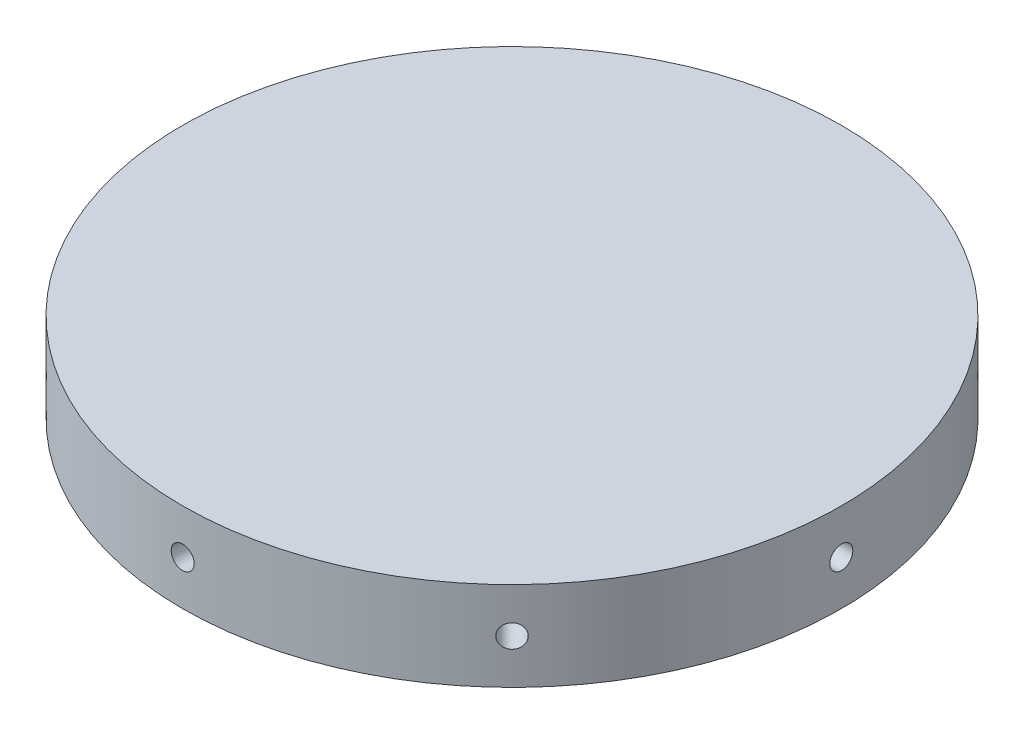
from build123d import *

# Parameters (mm, degrees)
SKETCH1_R                = 46.99
BULKHEAD_EXTRUSION_DEPTH = 12.7
SKETCH2_R                = 1.6383
SCREW_HOLE_DEPTH         = 12.7
CIRPATTERN1_COUNT        = 8


with BuildPart() as part:
    # Sketch1 → Bulkhead Extrusion (new body)
    with BuildSketch(Plane(origin=(0, 0, 0), x_dir=(1, 0, 0), z_dir=(0, 1, 0))):
        Circle(SKETCH1_R)
    extrude(amount=BULKHEAD_EXTRUSION_DEPTH)

    # Sketch2 → Screw Hole (cut)
    with BuildSketch(Plane.XY.offset(46.99)):
        with Locations((0, 6.35)):
            Circle(SKETCH2_R)
    screw_hole = extrude(amount=-SCREW_HOLE_DEPTH, mode=Mode.SUBTRACT)

    # CirPattern1: Screw Hole ×8 about axis
    cirpattern1_axis = Axis((0, 12.7, 0), (0, -1, 0))
    for i in range(1, CIRPATTERN1_COUNT):
        add(screw_hole.rotate(cirpattern1_axis, i * 360 / CIRPATTERN1_COUNT), mode=Mode.SUBTRACT)


solid = part.part
